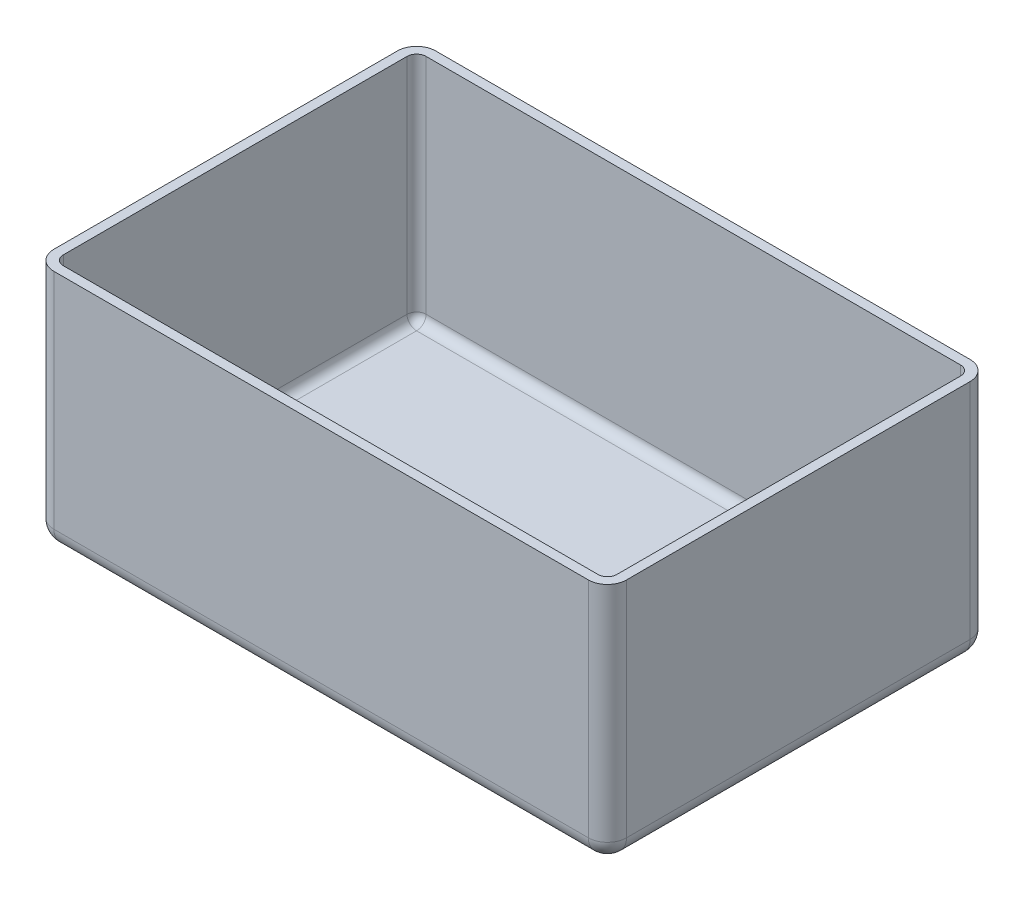
from build123d import *

# Parameters (mm, degrees)
SKETCH1_W           = 300
SKETCH1_H           = 200
BOSS_EXTRUDE1_DEPTH = 127
FILLET1_R           = 10
SHELL1_T            = -5


with BuildPart() as part:
    # Sketch1 → Boss-Extrude1 (new body)
    with BuildSketch(Plane(origin=(0, 0, 0), x_dir=(1, 0, 0), z_dir=(0, 1, 0))):
        Rectangle(SKETCH1_W, SKETCH1_H)
    extrude(amount=BOSS_EXTRUDE1_DEPTH)

    # Fillet1
    fillet1_edges = [part.edges().sort_by_distance(p)[0] for p in [
        (-150, 0, 0),
        (0, 0, 100),
        (150, 0, 0),
        (0, 0, -100),
        (150, 63.5, 100),
        (150, 63.5, -100),
        (-150, 63.5, -100),
        (-150, 63.5, 100),
    ]]
    fillet(fillet1_edges, radius=FILLET1_R)

    # Shell1
    shell1_openings = [part.faces().sort_by_distance(p)[0] for p in [
        (0, 127, 0),
    ]]
    offset(amount=SHELL1_T, openings=shell1_openings, kind=Kind.INTERSECTION)


solid = part.part
